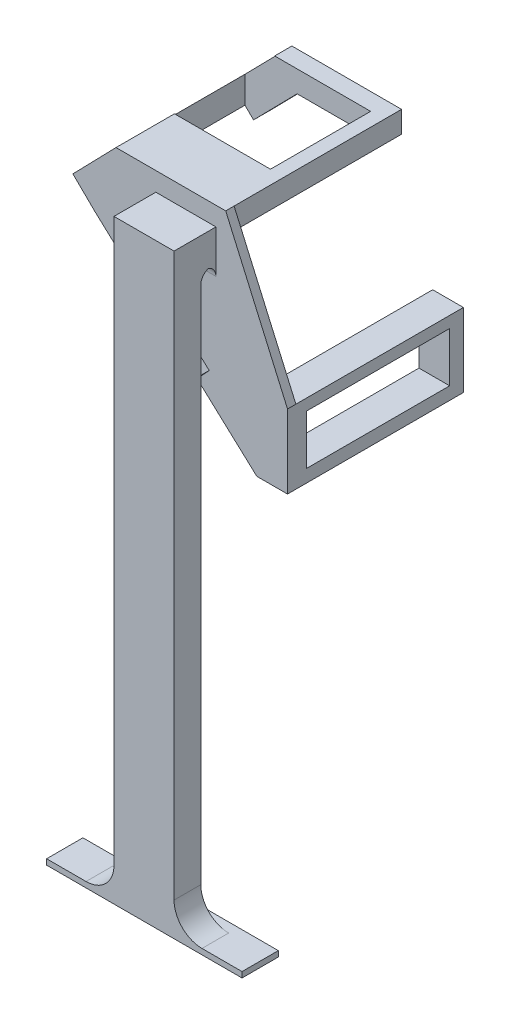
from build123d import *

# Parameters (mm, degrees)
BOSS_EXTRUDE1_DEPTH   = 60
SKETCH1_W             = 10.993820537
SKETCH1_H             = 26.396502677
BOSS_EXTRUDE1_2_DEPTH = 60
BOSS_EXTRUDE2_DEPTH   = 3
SKETCH3_W             = 21.528788888
SKETCH3_H             = 11.346253603
BOSS_EXTRUDE3_DEPTH   = 15
SKETCH4_W             = 21.528788888
SKETCH4_H             = 9.567300702
BOSS_EXTRUDE4_DEPTH   = 200
SKETCH5_W             = 51.310621716
SKETCH5_H             = 17.784956531
CUT_EXTRUDE1_DEPTH    = 200
SKETCH6_W             = 45.030110597
SKETCH6_H             = 35.891646976
CUT_EXTRUDE2_DEPTH    = 200
SKETCH7_W             = 70
SKETCH7_H             = 13
BOSS_EXTRUDE5_DEPTH   = 2
FILLET1_R             = 10
FILLET3_R             = 4
BOSS_EXTRUDE6_DEPTH   = 7


with BuildPart() as part:
    # Sketch1 → Boss-Extrude1 (new body)
    with BuildSketch(Plane.XY):
        Polygon((-19.757378597, 18.307693349), (11.507697245, 18.307693349), (11.507697245, 26.038756838), (-27.787096512, 26.038756838), (-27.787096512, 25.885892475), (-43.235049783, 10.14086318), (-35.355311996, 2.409799691), align=None)
    extrude(amount=BOSS_EXTRUDE1_DEPTH)



with BuildPart() as body_2:
    # Sketch1 → Boss-Extrude1 2 (new body)
    with BuildSketch(Plane.XY):
        with Locations((28.155491547, -37.552817793)):
            Rectangle(SKETCH1_W, SKETCH1_H)
    extrude(amount=BOSS_EXTRUDE1_2_DEPTH)


with BuildPart() as part_1:
    add(part.part)

    add(body_2.part)  # Boss-Extrude2 merges body 2
    # Sketch2 → Boss-Extrude2 (add)
    with BuildSketch(Plane.XY.offset(60)):
        Polygon((-43.235049783, 10.14086318), (-27.787096512, 26.038756838), (11.507697245, 26.038756838), (33.652401815, -24.354566454), (33.652401815, -50.751069131), (22.658581278, -50.751069131), (-35.355311996, 2.409799691), align=None)
    extrude(amount=BOSS_EXTRUDE2_DEPTH)

    # Sketch3 → Boss-Extrude3 (add)
    with BuildSketch(Plane.XY.offset(63)):
        with Locations((-2.754816927, 13.64397724)):
            Rectangle(SKETCH3_W, SKETCH3_H)
    extrude(amount=BOSS_EXTRUDE3_DEPTH)

    # Sketch4 → Boss-Extrude4 (add)
    with BuildSketch(Plane.XZ.offset(-7.970850439)):
        with Locations((-2.754816927, 73.216349649)):
            Rectangle(SKETCH4_W, SKETCH4_H)
    extrude(amount=BOSS_EXTRUDE4_DEPTH)

    # Sketch5 → Cut-Extrude1 (cut)
    with BuildSketch(Plane.ZY.offset(-22.658581278)):
        with Locations((30.574482512, -37.306256307)):
            Rectangle(SKETCH5_W, SKETCH5_H)
    extrude(amount=-CUT_EXTRUDE1_DEPTH, mode=Mode.SUBTRACT)

    # Sketch6 → Cut-Extrude2 (cut)
    with BuildSketch(Plane(origin=(0, 26.038756838, 0), x_dir=(1, 0, 0), z_dir=(0, 1, 0))):
        with Locations((-15.916410132, -24.110147888)):
            Rectangle(SKETCH6_W, SKETCH6_H)
    extrude(amount=-CUT_EXTRUDE2_DEPTH, mode=Mode.SUBTRACT)

    # Sketch7 → Boss-Extrude5 (add)
    with BuildSketch(Plane.XZ.offset(192.029149561)):
        with Locations((-2.644159555, 71.5)):
            Rectangle(SKETCH7_W, SKETCH7_H)
    extrude(amount=BOSS_EXTRUDE5_DEPTH)

    # Fillet1
    fillet1_edges = [part_1.edges().sort_by_distance(p)[0] for p in [
        (-13.519211371, -192.029149561, 73.216349649),
        (8.009577517, -192.029149561, 73.216349649),
    ]]
    fillet(fillet1_edges, radius=FILLET1_R)

    # Fillet3
    # the kernel refuses this fillet: 4 mm, written as the material it adds along each edge
    with BuildSketch(Plane(origin=(8.009577517, 7.970850439, 63), x_dir=(0, 0, 1), z_dir=(-1, 0, 0)), Plane(origin=(8.009577517, 7.970850439, 68.432699298), x_dir=(0, -1, 0), z_dir=(-1, 0, 0))) as fillet3_piece_1:
        with BuildLine():
            CenterArc((FILLET3_R, -FILLET3_R), FILLET3_R, 90, 90)
            Line((0, -FILLET3_R), (0, 0))
            Line((0, 0), (FILLET3_R, 0))
        make_face()
    extrude(amount=21.528788888)

    # Sketch8 → Boss-Extrude6 (add)
    with BuildSketch(Plane(origin=(0, 0, 68.432699298), x_dir=(-1, 0, 0), z_dir=(0, 0, -1))):
        Polygon((10.906624275, -19.993686913), (-1.270597079, -31.152249638), (-5.600185218, -26.427415943), (6.577036136, -15.268853218), align=None)
    extrude(amount=BOSS_EXTRUDE6_DEPTH)


solid = part_1.part
